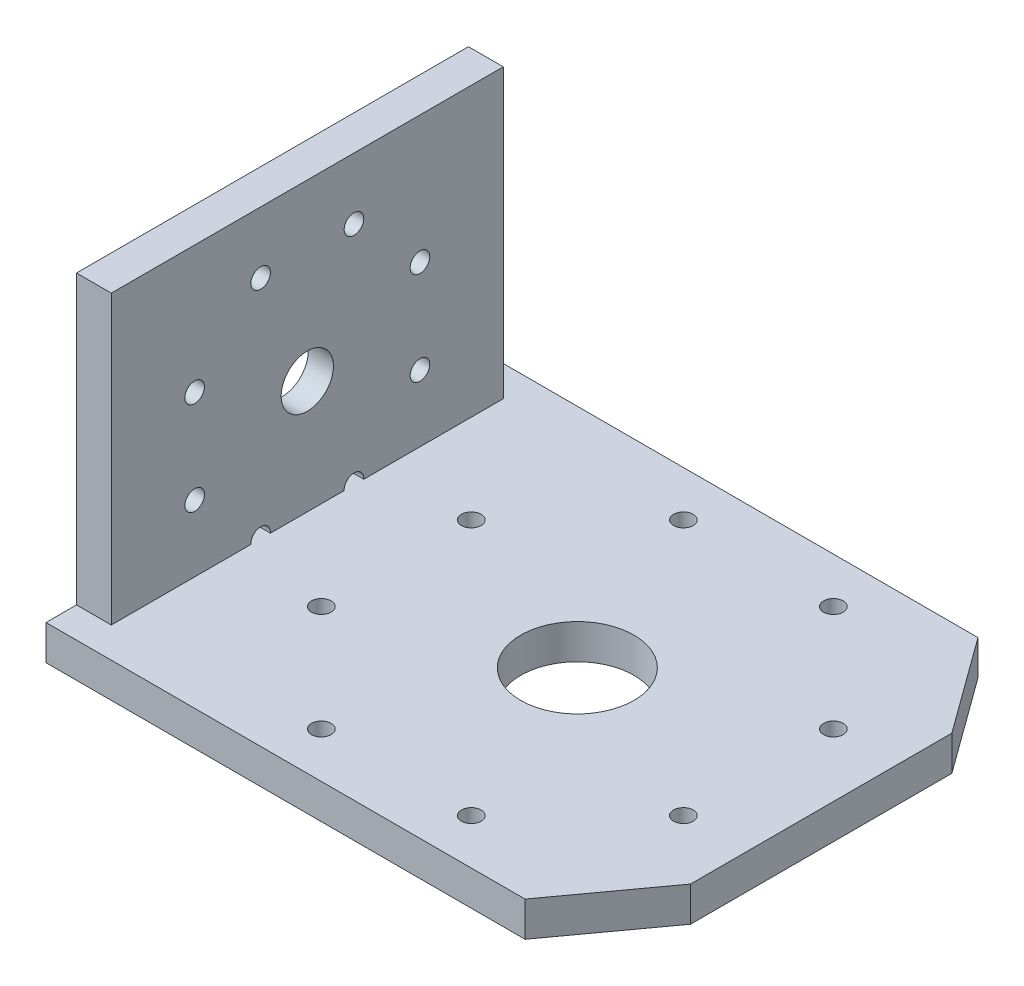
from build123d import *

# Parameters (mm, degrees)
SK_BACK_PLATE_W         = 90
SK_BACK_PLATE_H         = 74
SK_BACK_PLATE_R         = 2.25
SK_BACK_PLATE_R_2       = 6
BACK_PLATE_DEPTH        = 8
SK_ROLL_PILOT_RECESS_R  = 22.15
ROLL_PILOT_RECESS_DEPTH = 2.2
SK_MEDIAL_PLATE_R       = 2.25
SK_MEDIAL_PLATE_R_2     = 13
MEDIAL_PLATE_DEPTH      = 8


with BuildPart() as part:
    # SK_Back_Plate → Back_Plate (new body)
    with BuildSketch(Plane(origin=(-70, 0, 0), x_dir=(0, 0, -1), z_dir=(1, 0, 0))):
        with Locations((0, 3)):
            Rectangle(SK_BACK_PLATE_W, SK_BACK_PLATE_H)
        with Locations((25.86862691, 10.715136106)):
            Circle(SK_BACK_PLATE_R, mode=Mode.SUBTRACT)
        with Locations((10.715136106, 25.86862691)):
            Circle(SK_BACK_PLATE_R, mode=Mode.SUBTRACT)
        with Locations((-10.715136106, 25.86862691)):
            Circle(SK_BACK_PLATE_R, mode=Mode.SUBTRACT)
        with Locations((-25.86862691, 10.715136106)):
            Circle(SK_BACK_PLATE_R, mode=Mode.SUBTRACT)
        with Locations((-25.86862691, -10.715136106)):
            Circle(SK_BACK_PLATE_R, mode=Mode.SUBTRACT)
        with Locations((-10.715136106, -25.86862691)):
            Circle(SK_BACK_PLATE_R, mode=Mode.SUBTRACT)
        with Locations((10.715136106, -25.86862691)):
            Circle(SK_BACK_PLATE_R, mode=Mode.SUBTRACT)
        with Locations((25.86862691, -10.715136106)):
            Circle(SK_BACK_PLATE_R, mode=Mode.SUBTRACT)
        Circle(SK_BACK_PLATE_R_2, mode=Mode.SUBTRACT)
    extrude(amount=BACK_PLATE_DEPTH)

    # SK_Roll_Pilot_Recess → Roll_Pilot_Recess (cut)
    with BuildSketch(Plane(origin=(-70, 0, 0), x_dir=(0, 0, -1), z_dir=(1, 0, 0))):
        Circle(SK_ROLL_PILOT_RECESS_R)
    extrude(amount=ROLL_PILOT_RECESS_DEPTH, mode=Mode.SUBTRACT)

    # SK_Medial_Plate → Medial_Plate (add)
    with BuildSketch(Plane(origin=(0, -34, 0), x_dir=(1, 0, 0), z_dir=(0, 1, 0))):
        Polygon((-70, 52), (40, 52), (56, 30), (56, -30), (40, -52), (-70, -52), align=None)
        with Locations((41.574578963, 17.220754456)):
            Circle(SK_MEDIAL_PLATE_R, mode=Mode.SUBTRACT)
        with Locations((17.220754456, 41.574578963)):
            Circle(SK_MEDIAL_PLATE_R, mode=Mode.SUBTRACT)
        with Locations((-17.220754456, 41.574578963)):
            Circle(SK_MEDIAL_PLATE_R, mode=Mode.SUBTRACT)
        with Locations((-41.574578963, 17.220754456)):
            Circle(SK_MEDIAL_PLATE_R, mode=Mode.SUBTRACT)
        with Locations((-41.574578963, -17.220754456)):
            Circle(SK_MEDIAL_PLATE_R, mode=Mode.SUBTRACT)
        with Locations((-17.220754456, -41.574578963)):
            Circle(SK_MEDIAL_PLATE_R, mode=Mode.SUBTRACT)
        with Locations((17.220754456, -41.574578963)):
            Circle(SK_MEDIAL_PLATE_R, mode=Mode.SUBTRACT)
        with Locations((41.574578963, -17.220754456)):
            Circle(SK_MEDIAL_PLATE_R, mode=Mode.SUBTRACT)
        Circle(SK_MEDIAL_PLATE_R_2, mode=Mode.SUBTRACT)
    extrude(amount=MEDIAL_PLATE_DEPTH)


solid = part.part
